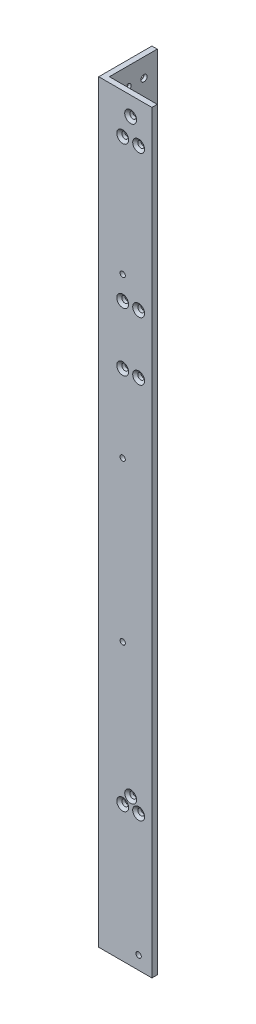
from build123d import *

# Parameters (mm, degrees)
BOSS_EXTRUDE1_DEPTH                               = 450
LEFTSIDEHOLES_SKETCH3_R                           = 1.5875
LEFTSIDEHOLES_CUT_EXTRUDE1_DEPTH                  = 3.175
BACKSIDEHOLES_SKETCH4_R                           = 1.5875
BACKSIDEHOLES_CUT_EXTRUDE2_DEPTH                  = 3.175
CSK_FOR_6_FLAT_HEAD_MACHINE_SCREW_100_D           = 3.7973
CSK_FOR_6_FLAT_HEAD_MACHINE_SCREW_100_CSINK_D     = 7.0866
CSK_FOR_6_FLAT_HEAD_MACHINE_SCREW_100_CSINK_ANGLE = 100
CSK_FOR_6_FLAT_HEAD_MACHINE_SCREW_2_D             = 3.7973
CSK_FOR_6_FLAT_HEAD_MACHINE_SCREW_2_CSINK_D       = 7.0866
CSK_FOR_6_FLAT_HEAD_MACHINE_SCREW_2_CSINK_ANGLE   = 100


with BuildPart() as part:
    # Sketch2 → Boss-Extrude1 (new body)
    with BuildSketch(Plane(origin=(0, 0, 0), x_dir=(1, 0, 0), z_dir=(0, 1, 0))):
        Polygon((0, 31.75), (3.175, 31.75), (3.175, 3.175), (31.75, 3.175), (31.75, 0), (0, 0), align=None)
    extrude(amount=BOSS_EXTRUDE1_DEPTH)

    # LeftSideHoles-Sketch3 → LeftSideHoles-Cut-Extrude1 (cut)
    with BuildSketch(Plane.XY):
        with Locations((14.2875, 81.1125)):
            Circle(LEFTSIDEHOLES_SKETCH3_R)
        with Locations((23.8125, 81.1125)):
            Circle(LEFTSIDEHOLES_SKETCH3_R)
        with Locations((19.05, 87.4625)):
            Circle(LEFTSIDEHOLES_SKETCH3_R)
        with Locations((14.2875, 426.1875)):
            Circle(LEFTSIDEHOLES_SKETCH3_R)
        with Locations((19.05, 438.8875)):
            Circle(LEFTSIDEHOLES_SKETCH3_R)
        with Locations((23.8125, 426.1875)):
            Circle(LEFTSIDEHOLES_SKETCH3_R)
        with Locations((14.2875, 341.24737)):
            Circle(LEFTSIDEHOLES_SKETCH3_R)
        with Locations((23.8125, 341.24737)):
            Circle(LEFTSIDEHOLES_SKETCH3_R)
        with Locations((14.2875, 306.32237)):
            Circle(LEFTSIDEHOLES_SKETCH3_R)
        with Locations((23.8125, 306.32237)):
            Circle(LEFTSIDEHOLES_SKETCH3_R)
        with Locations((23.8125, 7.9375)):
            Circle(LEFTSIDEHOLES_SKETCH3_R)
        with Locations((14.2875, 165)):
            Circle(LEFTSIDEHOLES_SKETCH3_R)
        with Locations((14.2875, 260)):
            Circle(LEFTSIDEHOLES_SKETCH3_R)
        with Locations((14.2875, 355)):
            Circle(LEFTSIDEHOLES_SKETCH3_R)
    extrude(amount=-LEFTSIDEHOLES_CUT_EXTRUDE1_DEPTH, mode=Mode.SUBTRACT)

    # BackSideHoles-Sketch4 → BackSideHoles-Cut-Extrude2 (cut)
    with BuildSketch(Plane.ZY):
        with Locations((-19.05, 81.1125)):
            Circle(BACKSIDEHOLES_SKETCH4_R)
        with Locations((-23.8125, 87.4625)):
            Circle(BACKSIDEHOLES_SKETCH4_R)
        with Locations((-14.2875, 87.4625)):
            Circle(BACKSIDEHOLES_SKETCH4_R)
        with Locations((-23.8125, 438.8875)):
            Circle(BACKSIDEHOLES_SKETCH4_R)
        with Locations((-14.2875, 438.8875)):
            Circle(BACKSIDEHOLES_SKETCH4_R)
        with Locations((-19.05, 426.1875)):
            Circle(BACKSIDEHOLES_SKETCH4_R)
        with Locations((-23.8125, 336.74737)):
            Circle(BACKSIDEHOLES_SKETCH4_R)
        with Locations((-14.2875, 336.74737)):
            Circle(BACKSIDEHOLES_SKETCH4_R)
        with Locations((-19.05, 330.39737)):
            Circle(BACKSIDEHOLES_SKETCH4_R)
        with Locations((-14.2875, 165)):
            Circle(BACKSIDEHOLES_SKETCH4_R)
        with Locations((-14.2875, 260)):
            Circle(BACKSIDEHOLES_SKETCH4_R)
        with Locations((-23.8125, 7.9375)):
            Circle(BACKSIDEHOLES_SKETCH4_R)
        with Locations((-14.2875, 355)):
            Circle(BACKSIDEHOLES_SKETCH4_R)
    extrude(amount=-BACKSIDEHOLES_CUT_EXTRUDE2_DEPTH, mode=Mode.SUBTRACT)

    # CSK for _6 Flat Head Machine Screw _100 (through all)
    with Locations(Plane.ZY):
        with Locations((-14.2875, 438.8875), (-23.8125, 438.8875), (-19.05, 426.1875), (-19.05, 330.39737), (-14.2875, 336.74737), (-23.8125, 336.74737), (-19.05, 81.1125), (-14.2875, 87.4625), (-23.8125, 87.4625)):
            CounterSinkHole(CSK_FOR_6_FLAT_HEAD_MACHINE_SCREW_100_D / 2, CSK_FOR_6_FLAT_HEAD_MACHINE_SCREW_100_CSINK_D / 2, counter_sink_angle=CSK_FOR_6_FLAT_HEAD_MACHINE_SCREW_100_CSINK_ANGLE)

    # CSK for _6 Flat Head Machine Screw _ 2 (through all)
    with Locations(Plane.XY):
        with Locations((19.05, 438.8875), (14.2875, 426.1875), (23.8125, 426.1875), (23.8125, 341.24737), (14.2875, 341.24737), (14.2875, 306.32237), (23.8125, 306.32237), (19.05, 87.4625), (14.2875, 81.1125), (23.8125, 81.1125)):
            CounterSinkHole(CSK_FOR_6_FLAT_HEAD_MACHINE_SCREW_2_D / 2, CSK_FOR_6_FLAT_HEAD_MACHINE_SCREW_2_CSINK_D / 2, counter_sink_angle=CSK_FOR_6_FLAT_HEAD_MACHINE_SCREW_2_CSINK_ANGLE)


solid = part.part
